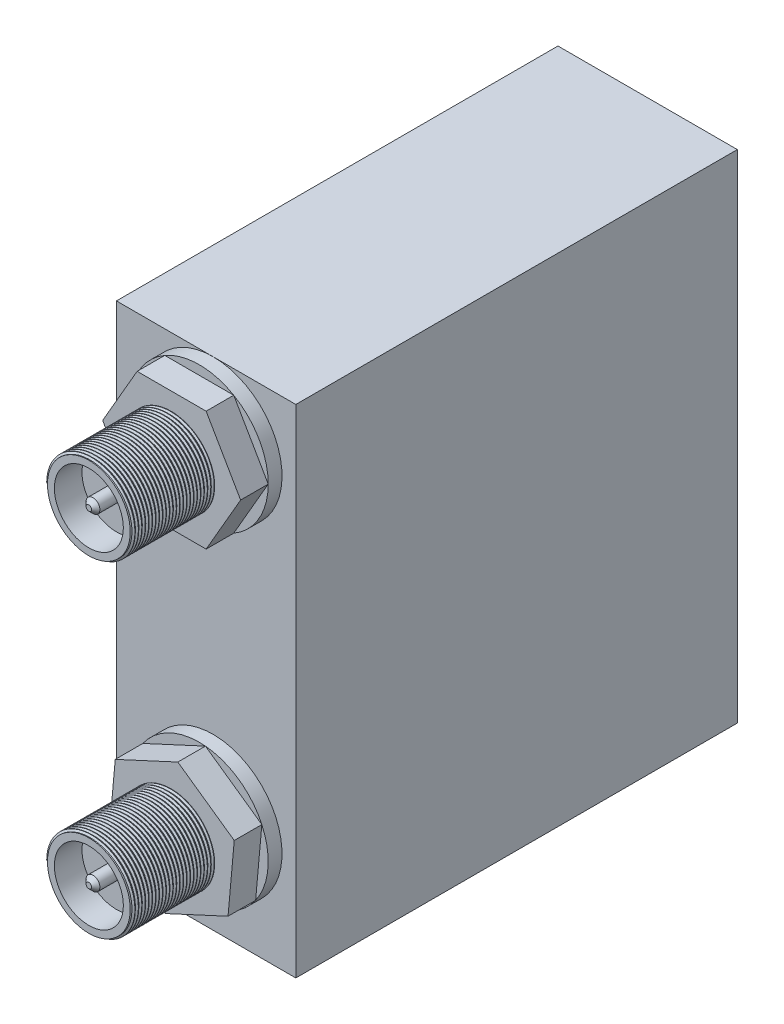
from build123d import *
from build123d.topology import SkipClean

# Parameters (mm, degrees)
SKETCH1_W           = 13
SKETCH1_H           = 32
BOSS_EXTRUDE1_DEPTH = 36
SKETCH2_R           = 5
BOSS_EXTRUDE2_DEPTH = 1
BOSS_EXTRUDE3_DEPTH = 2
SKETCH4_R           = 3
BOSS_EXTRUDE4_DEPTH = 6
SKETCH5_R           = 2.5
SKETCH5_R_2         = 0.5
CUT_EXTRUDE2_DEPTH  = 2
CHAMFER1_SIZE       = 0.3
THREAD1_PITCH       = 0.25
THREAD2_PITCH       = 0.25


with BuildPart() as part:
    # Sketch1 → Boss-Extrude1 (new body)
    with BuildSketch(Plane(origin=(0, 0, 0), x_dir=(1, 0, 0), z_dir=(0, 1, 0))):
        Rectangle(SKETCH1_W, SKETCH1_H)
    extrude(amount=BOSS_EXTRUDE1_DEPTH)

    # Sketch2 → Boss-Extrude2 (add)
    with BuildSketch(Plane.XY.offset(16)):
        with Locations(Location((0.5, 31, 0), (0, 0, 90))):
            Circle(SKETCH2_R)
        with Locations(Location((0.5, 7.3, 0), (0, 0, 180))):
            Circle(SKETCH2_R)
    extrude(amount=BOSS_EXTRUDE2_DEPTH)

    # Sketch3 → Boss-Extrude3 (add)
    with BuildSketch(Plane.XY.offset(17)):
        Polygon((5.5, 31), (3, 35.330127019), (-2, 35.330127019), (-4.5, 31), (-2, 26.669872981), (3, 26.669872981), align=None)
        Polygon((5.037346197, 9.400592651), (0.9495065, 12.279753398), (-3.587839697, 10.179160747), (-4.037346197, 5.199407349), (0.0504935, 2.320246602), (4.587839697, 4.420839253), align=None)
    extrude(amount=BOSS_EXTRUDE3_DEPTH)

    # Sketch4 → Boss-Extrude4 (add)
    with BuildSketch(Plane.XY.offset(19)):
        with Locations((0.5, 31)):
            Circle(SKETCH4_R)
        with Locations((0.5, 7.3)):
            Circle(SKETCH4_R)
    extrude(amount=BOSS_EXTRUDE4_DEPTH)

    # Sketch5 → Cut-Extrude2 (cut)
    # profile 1 of 2: a face of its own
    with BuildSketch(Plane.XY.offset(25)):
        with Locations((0.5, 31)):
            Circle(SKETCH5_R)
        with Locations((0.5, 31)):
            Circle(SKETCH5_R_2, mode=Mode.SUBTRACT)
    # profile 2 of 2: a face of its own
    with BuildSketch(Plane.XY.offset(25)):
        with Locations((0.5, 7.3)):
            Circle(SKETCH5_R)
        with Locations((0.5, 7.3)):
            Circle(SKETCH5_R_2, mode=Mode.SUBTRACT)
    extrude(amount=-CUT_EXTRUDE2_DEPTH, mode=Mode.SUBTRACT)

    # Chamfer1
    chamfer1_edges = [part.edges().sort_by_distance(p)[0] for p in [
        (0, 31, 25),
        (0, 7.3, 25),
    ]]
    chamfer(chamfer1_edges, length=CHAMFER1_SIZE)

    # Thread1: the profile of Thread Profile1 profile screwed along a right-hand helix of 24 turns, 6 arcs to a turn; built about Z, then put on its axis
    with SkipClean():  # the faces are left unmerged after this step: merging them gives an invalid solid
        thread1_z = Axis((0, 0, 0), (0, 0, 1))
        thread1_corners = [(2.9997, 0, -0.000173205), (3.135316469, 0, 0.078125), (3.135316469, 0, 0.109375), (2.9997, 0, 0.187673204)]
        with BuildLine(mode=Mode.PRIVATE) as thread1_profile:
            Line(thread1_corners[0], thread1_corners[1])
            Line(thread1_corners[1], thread1_corners[2])
            Line(thread1_corners[2], thread1_corners[3])
            Line(thread1_corners[3], thread1_corners[0])
        thread1_cap = Face(thread1_profile.wire())
        thread1_turn_angles = [0, 30, 60, 90, 120, 150, 180, 210, 240, 270, 300, 330, 360]
        thread1_turn_weights = [1, 0.8660254037844387, 1, 0.8660254037844387, 1, 0.8660254037844387, 1, 0.8660254037844387, 1, 0.8660254037844387, 1, 0.8660254037844387, 1]
        thread1_turn_rails = [Edge.make_bspline([Vector(p[0], p[1], 0).rotate(thread1_z, thread1_turn_angles[k]) / thread1_turn_weights[k] + Vector(0, 0, p[2] + THREAD1_PITCH * thread1_turn_angles[k] / 360) for k in range(13)], [0, 0, 0, 1, 1, 2, 2, 3, 3, 4, 4, 5, 5, 6, 6, 6], 2, thread1_turn_weights) for p in thread1_corners]
        thread1_turn_sides = [Face.make_surface_from_curves(thread1_turn_rails[p[0]], thread1_turn_rails[p[1]]) for p in [(0, 1), (1, 2), (2, 3), (3, 0)]]
        thread1 = Plane(origin=(0.5, 31, 25), x_dir=(-1, 0, 0), z_dir=(0, 0, -1)) * Solid(Shell([*[p.moved(Location((0, 0, THREAD1_PITCH * i))) for i in range(24) for p in thread1_turn_sides], thread1_cap, thread1_cap.rotate(thread1_z, 8640).moved(Location((0, 0, THREAD1_PITCH * 8640 / 360)))]))
        add(thread1)

    # Thread2: the profile of Thread Profile2 profile screwed along a right-hand helix of 24 turns, 6 arcs to a turn; built about Z, then put on its axis
    with SkipClean():  # the faces are left unmerged after this step: merging them gives an invalid solid
        thread2_z = Axis((0, 0, 0), (0, 0, 1))
        thread2_corners = [(2.9997, 0, -0.000173205), (3.135316469, 0, 0.078125), (3.135316469, 0, 0.109375), (2.9997, 0, 0.187673204)]
        with BuildLine(mode=Mode.PRIVATE) as thread2_profile:
            Line(thread2_corners[0], thread2_corners[1])
            Line(thread2_corners[1], thread2_corners[2])
            Line(thread2_corners[2], thread2_corners[3])
            Line(thread2_corners[3], thread2_corners[0])
        thread2_cap = Face(thread2_profile.wire())
        thread2_turn_angles = [0, 30, 60, 90, 120, 150, 180, 210, 240, 270, 300, 330, 360]
        thread2_turn_weights = [1, 0.8660254037844387, 1, 0.8660254037844387, 1, 0.8660254037844387, 1, 0.8660254037844387, 1, 0.8660254037844387, 1, 0.8660254037844387, 1]
        thread2_turn_rails = [Edge.make_bspline([Vector(p[0], p[1], 0).rotate(thread2_z, thread2_turn_angles[k]) / thread2_turn_weights[k] + Vector(0, 0, p[2] + THREAD2_PITCH * thread2_turn_angles[k] / 360) for k in range(13)], [0, 0, 0, 1, 1, 2, 2, 3, 3, 4, 4, 5, 5, 6, 6, 6], 2, thread2_turn_weights) for p in thread2_corners]
        thread2_turn_sides = [Face.make_surface_from_curves(thread2_turn_rails[p[0]], thread2_turn_rails[p[1]]) for p in [(0, 1), (1, 2), (2, 3), (3, 0)]]
        thread2 = Plane(origin=(0.5, 7.3, 25), x_dir=(-1, 0, 0), z_dir=(0, 0, -1)) * Solid(Shell([*[p.moved(Location((0, 0, THREAD2_PITCH * i))) for i in range(24) for p in thread2_turn_sides], thread2_cap, thread2_cap.rotate(thread2_z, 8640).moved(Location((0, 0, THREAD2_PITCH * 8640 / 360)))]))
        add(thread2)


solid = part.part
